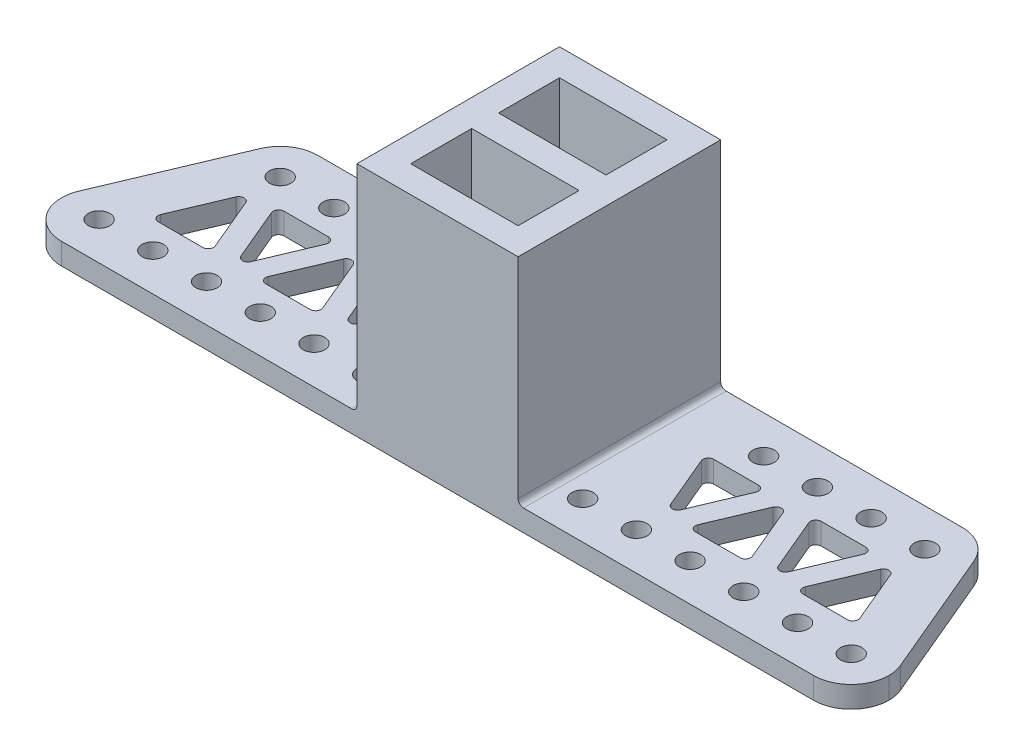
from build123d import *

# Parameters (mm, degrees)
SKETCH_1_W               = 154
SKETCH_1_H               = 37.7
EXTRUDE_1_DEPTH          = 4
CUT_EXTRUDE_1_DEPTH      = 80.374570865
CUT_EXTRUDE_1_DEPTH_BACK = 80.374570865
SKETCH_2_R               = 2
CUT_EXTRUDE_2_DEPTH      = 80.374570865
CUT_EXTRUDE_2_DEPTH_BACK = 80.374570865
FILLET_1_R               = 7
SKETCH_4_W               = 30
SKETCH_4_H               = 37.7
EXTRUDE_2_DEPTH          = 40
CUT_EXTRUDE_3_DEPTH      = 89.793707547
CUT_EXTRUDE_3_DEPTH_BACK = 89.793707547
SKETCH_5_W               = 20
SKETCH_5_H               = 11.35
CUT_EXTRUDE_4_DEPTH      = 89.793707547
CUT_EXTRUDE_4_DEPTH_BACK = 89.793707547
FILLET_2_R               = 1
FILLET_4_R               = 1


with BuildPart() as part:
    # 草图1 → 凸台-拉伸1 (new body)
    with BuildSketch(Plane(origin=(0, 0, 0), x_dir=(1, 0, 0), z_dir=(0, 1, 0))):
        Rectangle(SKETCH_1_W, SKETCH_1_H)
    extrude(amount=-EXTRUDE_1_DEPTH)

    # 草图2 → 切除-拉伸1 (cut, two sides: drawn at the far end of the back side and taken through both)
    with BuildSketch(Plane(origin=(0, 0, 0), x_dir=(1, 0, 0), z_dir=(0, 1, 0)).offset(-CUT_EXTRUDE_1_DEPTH_BACK)):
        with Locations(Location((-30, 11.85, 0), (0, 0, 270))):
            Circle(SKETCH_2_R)
        with Locations(Location((-20, -11.85, 0), (0, 0, 270))):
            Circle(SKETCH_2_R)
        with Locations(Location((-40, 11.85, 0), (0, 0, 270))):
            Circle(SKETCH_2_R)
        with Locations(Location((-50, 11.85, 0), (0, 0, 270))):
            Circle(SKETCH_2_R)
        with Locations(Location((-60, 11.85, 0), (0, 0, 270))):
            Circle(SKETCH_2_R)
        with Locations(Location((-30, -11.85, 0), (0, 0, 270))):
            Circle(SKETCH_2_R)
        with Locations(Location((-40, -11.85, 0), (0, 0, 270))):
            Circle(SKETCH_2_R)
        with Locations(Location((-50, -11.85, 0), (0, 0, 270))):
            Circle(SKETCH_2_R)
        with Locations(Location((-60, -11.85, 0), (0, 0, 270))):
            Circle(SKETCH_2_R)
        with Locations(Location((-70, -11.85, 0), (0, 0, 270))):
            Circle(SKETCH_2_R)
        with Locations(Location((20, -11.85, 0), (0, 0, 270))):
            Circle(SKETCH_2_R)
        with Locations(Location((30, -11.85, 0), (0, 0, 270))):
            Circle(SKETCH_2_R)
        with Locations(Location((40, -11.85, 0), (0, 0, 270))):
            Circle(SKETCH_2_R)
        with Locations(Location((50, -11.85, 0), (0, 0, 270))):
            Circle(SKETCH_2_R)
        with Locations(Location((60, -11.85, 0), (0, 0, 270))):
            Circle(SKETCH_2_R)
        with Locations(Location((70, -11.85, 0), (0, 0, 270))):
            Circle(SKETCH_2_R)
        with Locations(Location((30, 11.85, 0), (0, 0, 270))):
            Circle(SKETCH_2_R)
        with Locations(Location((40, 11.85, 0), (0, 0, 270))):
            Circle(SKETCH_2_R)
        with Locations(Location((50, 11.85, 0), (0, 0, 270))):
            Circle(SKETCH_2_R)
        with Locations(Location((60, 11.85, 0), (0, 0, 270))):
            Circle(SKETCH_2_R)
    extrude(amount=CUT_EXTRUDE_1_DEPTH + CUT_EXTRUDE_1_DEPTH_BACK, mode=Mode.SUBTRACT)

    # 草图3 → 切除-拉伸2 (cut, two sides: drawn at the far end of the back side and taken through both)
    with BuildSketch(Plane(origin=(0, 0, 0), x_dir=(1, 0, 0), z_dir=(0, 1, 0)).offset(-CUT_EXTRUDE_2_DEPTH_BACK)):
        Polygon((-64.644023205, 18.85), (-77, -10.433665004), (-77, 18.85), align=None)
        Polygon((64.644023205, 18.85), (77, -10.433665004), (77, 18.85), align=None)
    extrude(amount=CUT_EXTRUDE_2_DEPTH + CUT_EXTRUDE_2_DEPTH_BACK, mode=Mode.SUBTRACT)

    # 圆角1
    fillet_1_edges = [part.edges().sort_by_distance(p)[0] for p in [
        (77, -2, 18.85),
        (77, -2, 10.433665004),
        (64.644023205, -2, -18.85),
        (-77, -2, 18.85),
        (-77, -2, 10.433665004),
        (-64.644023205, -2, -18.85),
    ]]
    fillet(fillet_1_edges, radius=FILLET_1_R - 0.0001)  # a hair under: the kernel refuses the full size

    # 草图4 → 凸台-拉伸2 (add)
    with BuildSketch(Plane(origin=(0, 0, 0), x_dir=(1, 0, 0), z_dir=(0, 1, 0))):
        Rectangle(SKETCH_4_W, SKETCH_4_H)
    extrude(amount=EXTRUDE_2_DEPTH)

    # 草图5 → 切除-拉伸3 (cut, two sides: drawn at the far end of the back side and taken through both)
    with BuildSketch(Plane(origin=(0, 0, 0), x_dir=(1, 0, 0), z_dir=(0, 1, 0)).offset(-CUT_EXTRUDE_3_DEPTH_BACK)):
        with Locations((0, 8.175)):
            Rectangle(SKETCH_5_W, SKETCH_5_H)
        with Locations((0, -8.175)):
            Rectangle(SKETCH_5_W, SKETCH_5_H)
    extrude(amount=CUT_EXTRUDE_3_DEPTH + CUT_EXTRUDE_3_DEPTH_BACK, mode=Mode.SUBTRACT)

    # 草图6 → 切除-拉伸4 (cut, two sides: drawn at the far end of the back side and taken through both)
    with BuildSketch(Plane(origin=(0, 0, 0), x_dir=(1, 0, 0), z_dir=(0, 1, 0)).offset(-CUT_EXTRUDE_4_DEPTH_BACK)):
        Polygon((-34.341491259, -6.705332858), (-40, 6.705332858), (-45.658508741, -6.705332858), align=None)
        Polygon((-55.658508741, 6.705332858), (-50, -6.705332858), (-44.341491259, 6.705332858), align=None)
        Polygon((-60, 6.705332858), (-65.658508741, -6.705332858), (-54.341491259, -6.705332858), align=None)
        Polygon((-35.658508741, 6.705332858), (-30, -6.705332858), (-24.341491259, 6.705332858), align=None)
        Polygon((24.341491259, 6.705332858), (35.658508741, 6.705332858), (30, -6.705332858), align=None)
        Polygon((45.658508741, -6.705332858), (34.341491259, -6.705332858), (40, 6.705332858), align=None)
        Polygon((44.341491259, 6.705332858), (55.658508741, 6.705332858), (50, -6.705332858), align=None)
        Polygon((65.658508741, -6.705332858), (54.341491259, -6.705332858), (60, 6.705332858), align=None)
    extrude(amount=CUT_EXTRUDE_4_DEPTH + CUT_EXTRUDE_4_DEPTH_BACK, mode=Mode.SUBTRACT)

    # 圆角2
    fillet_2_edges = [part.edges().sort_by_distance(p)[0] for p in [
        (50, -2, 6.705332858),
        (44.341491259, -2, -6.705332858),
        (55.658508741, -2, -6.705332858),
        (40, -2, -6.705332858),
        (45.658508741, -2, 6.705332858),
        (34.341491259, -2, 6.705332858),
        (60, -2, -6.705332858),
        (65.658508741, -2, 6.705332858),
        (54.341491259, -2, 6.705332858),
        (-45.658508741, -2, 6.705332858),
        (-40, -2, -6.705332858),
        (-34.341491259, -2, 6.705332858),
        (-60, -2, -6.705332858),
        (-54.341491259, -2, 6.705332858),
        (-65.658508741, -2, 6.705332858),
        (-24.341491259, -2, -6.705332858),
        (-30, -2, 6.705332858),
        (-35.658508741, -2, -6.705332858),
        (-44.341491259, -2, -6.705332858),
        (-50, -2, 6.705332858),
        (-55.658508741, -2, -6.705332858),
        (30, -2, 6.705332858),
        (24.341491259, -2, -6.705332858),
        (35.658508741, -2, -6.705332858),
    ]]
    fillet(fillet_2_edges, radius=FILLET_2_R)

    # 圆角4
    fillet_4_edges = [part.edges().sort_by_distance(p)[0] for p in [
        (-15, 0, 0),
        (15, 0, 0),
    ]]
    fillet(fillet_4_edges, radius=FILLET_4_R)


solid = part.part
